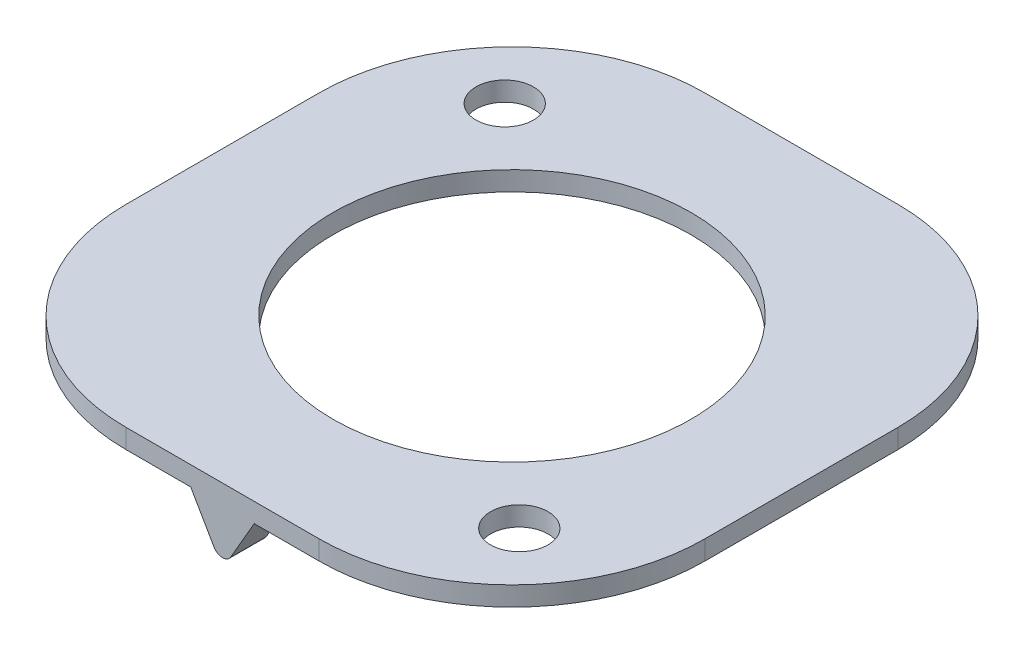
from build123d import *

# Parameters (mm, degrees)
BASISTEIL_MOLDINGFORMUMRELLAV1_0_0_SAK_1_START = 19
BASISTEIL_MOLDINGFORMUMRELLAV1_0_0_S_2_R       = 1.49
BASISTEIL_MOLDINGFORMUMRELLAV1_0_0_S_2_R_2     = 9.27775
BASISTEIL_MOLDINGFORMUMRELLAV1_0_0_SAK_1_DEPTH = 1
AUFSATZ_LINEAR_AUSTRAGEN1_DEPTH                = 1.85
VERRUNDUNG1_R                                  = 0.5


# Read off the part's stored shape, not the designer's step: Basisteil-MoldingFormUmrellaV1_0_0_SAK-1
with BuildPart() as part:
    # Basisteil-MoldingFormUmrellaV1_0_0_S 2 → Basisteil-MoldingFormUmrellaV1_0_0_SAK-1 (new body)
    with BuildSketch(Plane(origin=(0, 0, 0), x_dir=(1, 0, 0), z_dir=(0, 1, 0)).offset(BASISTEIL_MOLDINGFORMUMRELLAV1_0_0_SAK_1_START)):
        with BuildLine():
            Line((5, 15), (-5, 15))
            ThreePointArc((-5, 15), (-12.071067812, 12.071067812), (-15, 5))
            Line((-15, 5), (-15, -5))
            ThreePointArc((-15, -5), (-12.071067812, -12.071067812), (-5, -15))
            Line((-5, -15), (5, -15))
            ThreePointArc((5, -15), (12.071067812, -12.071067812), (15, -5))
            Line((15, -5), (15, 5))
            ThreePointArc((15, 5), (12.071067812, 12.071067812), (5, 15))
        make_face()
        with Locations((9.718159066, -9.341055177)):
            Circle(BASISTEIL_MOLDINGFORMUMRELLAV1_0_0_S_2_R, mode=Mode.SUBTRACT)
        with Locations((-9.718159066, 9.341055177)):
            Circle(BASISTEIL_MOLDINGFORMUMRELLAV1_0_0_S_2_R, mode=Mode.SUBTRACT)
        Circle(BASISTEIL_MOLDINGFORMUMRELLAV1_0_0_S_2_R_2, mode=Mode.SUBTRACT)
    extrude(amount=BASISTEIL_MOLDINGFORMUMRELLAV1_0_0_SAK_1_DEPTH)

    # Skizze1 → Aufsatz-Linear austragen1 (add)
    with BuildSketch(Plane(origin=(0, 0, -15), x_dir=(-1, 0, 0), z_dir=(0, 0, -1))):
        Polygon((0, 16.15), (1.861417329, 19.374069389), (-1.861417329, 19.374069389), align=None)
    aufsatz_linear_austragen1 = extrude(amount=-AUFSATZ_LINEAR_AUSTRAGEN1_DEPTH)

    # Spiegeln1: Aufsatz-Linear austragen1 across plane
    add(aufsatz_linear_austragen1.mirror(Plane(origin=(0, 0, 0), x_dir=(1, 0, 0), z_dir=(0, 0, -1))))

    # Verrundung1
    verrundung1_edges = [part.edges().sort_by_distance(p)[0] for p in [
        (0, 16.15, -14.075),
        (0, 16.15, 14.075),
    ]]
    fillet(verrundung1_edges, radius=VERRUNDUNG1_R)


solid = part.part
